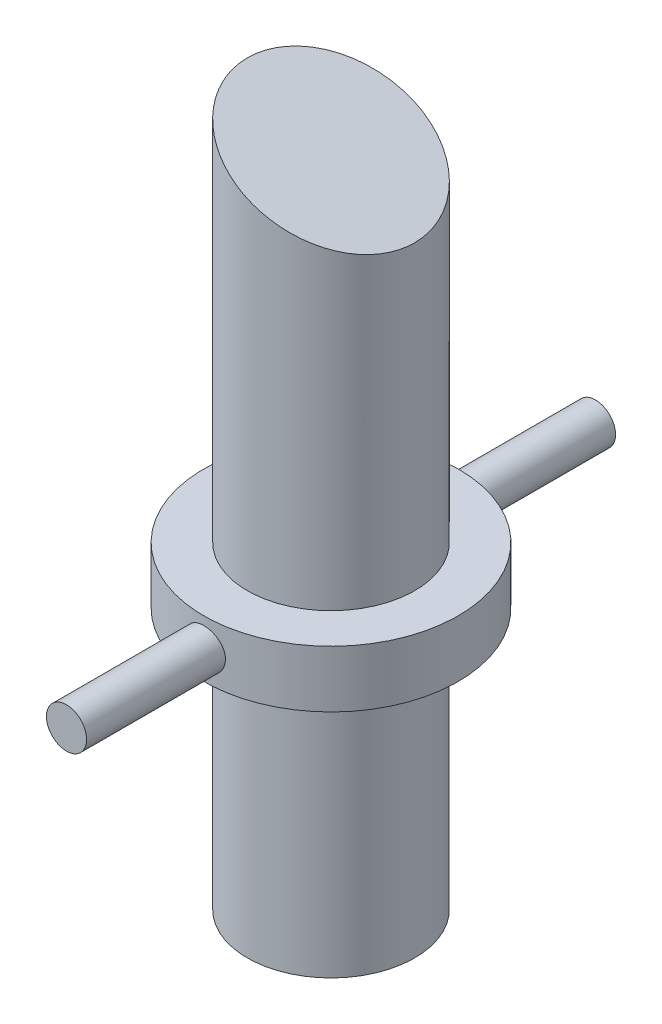
from build123d import *

# Parameters (mm, degrees)
CUT_EXTRUDE1_DEPTH      = 215.674613074
CUT_EXTRUDE1_DEPTH_BACK = 215.674613074
SKETCH5_R               = 6
BOSS_EXTRUDE1_DEPTH     = 79
SKETCH6_R               = 6
BOSS_EXTRUDE3_DEPTH     = 79


with BuildPart() as part:
    # Sketch1 → Revolve1 (revolve)
    with BuildSketch(Plane.XY):
        Polygon((0, 0), (0, 207.839335782), (25, 207.839335782), (25, 95), (38, 95), (38, 78), (25, 78), (25, 0), align=None)
    revolve(axis=Axis((0, 0, 0), (0, 1, 0)))

    # Sketch2 → Cut-Extrude1 (cut, two sides: drawn at the far end of the back side and taken through both)
    with BuildSketch(Plane.XY.offset(-CUT_EXTRUDE1_DEPTH_BACK)):
        Polygon((-429.184457716, 392.465426735), (-25, 207.839335782), (25, 185), (429.184457716, 0.373909047), (798.436639622, 808.742824479), (-59.93227581, 1200.834342167), align=None)
    extrude(amount=CUT_EXTRUDE1_DEPTH + CUT_EXTRUDE1_DEPTH_BACK, mode=Mode.SUBTRACT)

    # Sketch5 → Boss-Extrude1 (add)
    with BuildSketch(Plane.XY):
        with Locations((0, 86.5)):
            Circle(SKETCH5_R)
    extrude(amount=BOSS_EXTRUDE1_DEPTH)

    # Sketch6 → Boss-Extrude3 (add)
    with BuildSketch(Plane.XY):
        with Locations((0, 86.35404505)):
            Circle(SKETCH6_R)
    extrude(amount=-BOSS_EXTRUDE3_DEPTH)


solid = part.part
